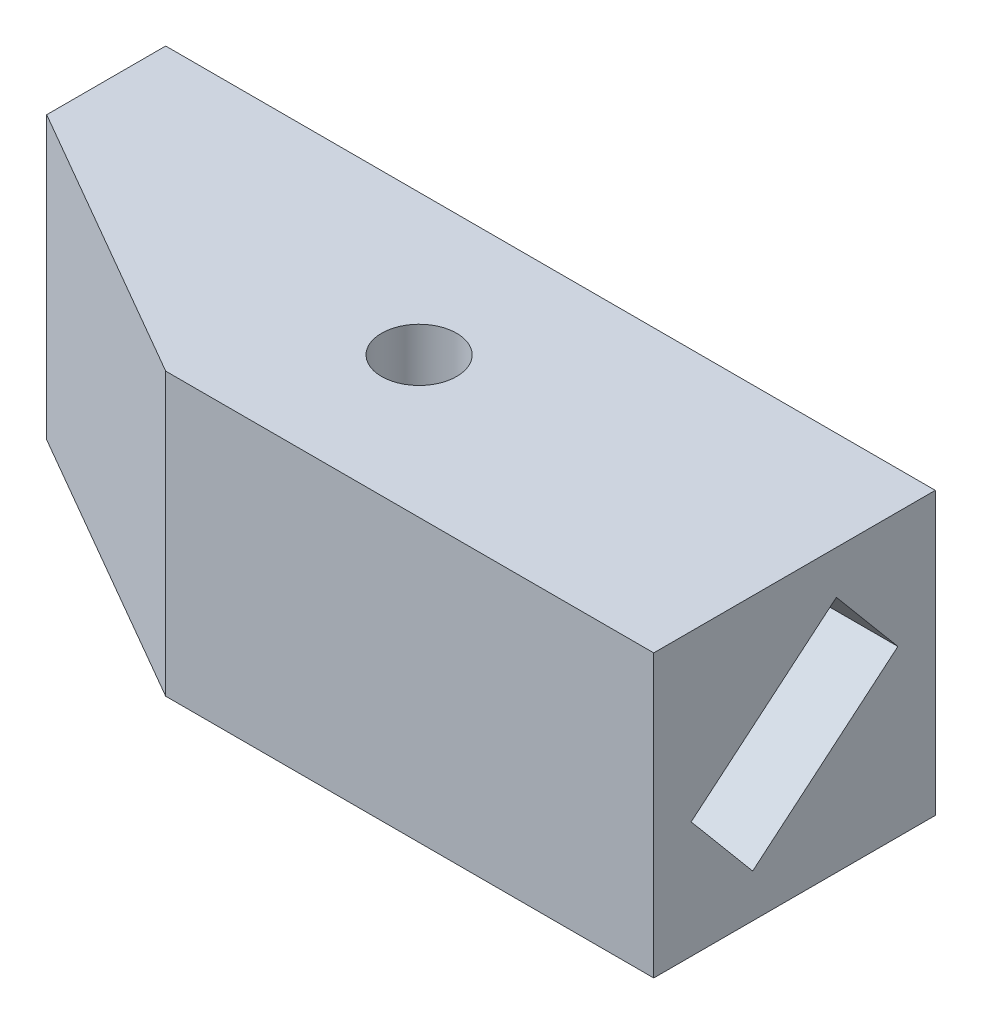
from build123d import *

# Parameters (mm, degrees)
EXTRUDE_1_DEPTH     = 30
SKETCH_2_R          = 4
CUT_EXTRUDE_1_DEPTH = 49.476798574
CUT_EXTRUDE_4_DEPTH = 30
SKETCH1_W           = 30
SKETCH1_H           = 30
BOSS_EXTRUDE1_DEPTH = 27
CHAMFER1_SIZE       = 30
CHAMFER1_SIZE2      = 17.320508076


with BuildPart() as part:
    # Эскиз1 → Бобышка-Вытянуть1 (new body)
    with BuildSketch(Plane(origin=(0, 0, 0), x_dir=(1, 0, 0), z_dir=(0, 1, 0))):
        Polygon((-20, 15), (-35, 15), (-35, -15), (-20, -15), (20, -15), (20, 15), align=None)
    extrude(amount=EXTRUDE_1_DEPTH)

    # Эскиз2 → Вырез-Вытянуть1 (cut, through all)
    with BuildSketch(Plane(origin=(0, 30, 0), x_dir=(1, 0, 0), z_dir=(0, 1, 0))):
        with Locations((-20, 0)):
            Circle(SKETCH_2_R)
    extrude(amount=-CUT_EXTRUDE_1_DEPTH, mode=Mode.SUBTRACT)

    # Эскиз5 → Вырез-Вытянуть4 (cut)
    with BuildSketch(Plane(origin=(20, 0, 0), x_dir=(0, 0, -1), z_dir=(1, 0, 0))):
        Polygon((11.015265685, 17.585328198), (4.458832066, 25.398981518), (-11.015265685, 12.414671802), (-4.458832066, 4.601018482), align=None)
    extrude(amount=-CUT_EXTRUDE_4_DEPTH, mode=Mode.SUBTRACT)

    # Sketch1 → Boss-Extrude1 (add)
    with BuildSketch(Plane.ZY.offset(35)):
        with Locations((0, 15)):
            Rectangle(SKETCH1_W, SKETCH1_H)
    extrude(amount=BOSS_EXTRUDE1_DEPTH)

    # Chamfer1
    chamfer1_edges = [part.edges().sort_by_distance(p)[0] for p in [
        (-62, 15, 15),
    ]]
    chamfer1_side = [part.faces().sort_by_distance(p)[0] for p in [
        (-21, 15, 15),
    ]]
    chamfer(chamfer1_edges, length=CHAMFER1_SIZE, length2=CHAMFER1_SIZE2, reference=chamfer1_side[0])


solid = part.part
